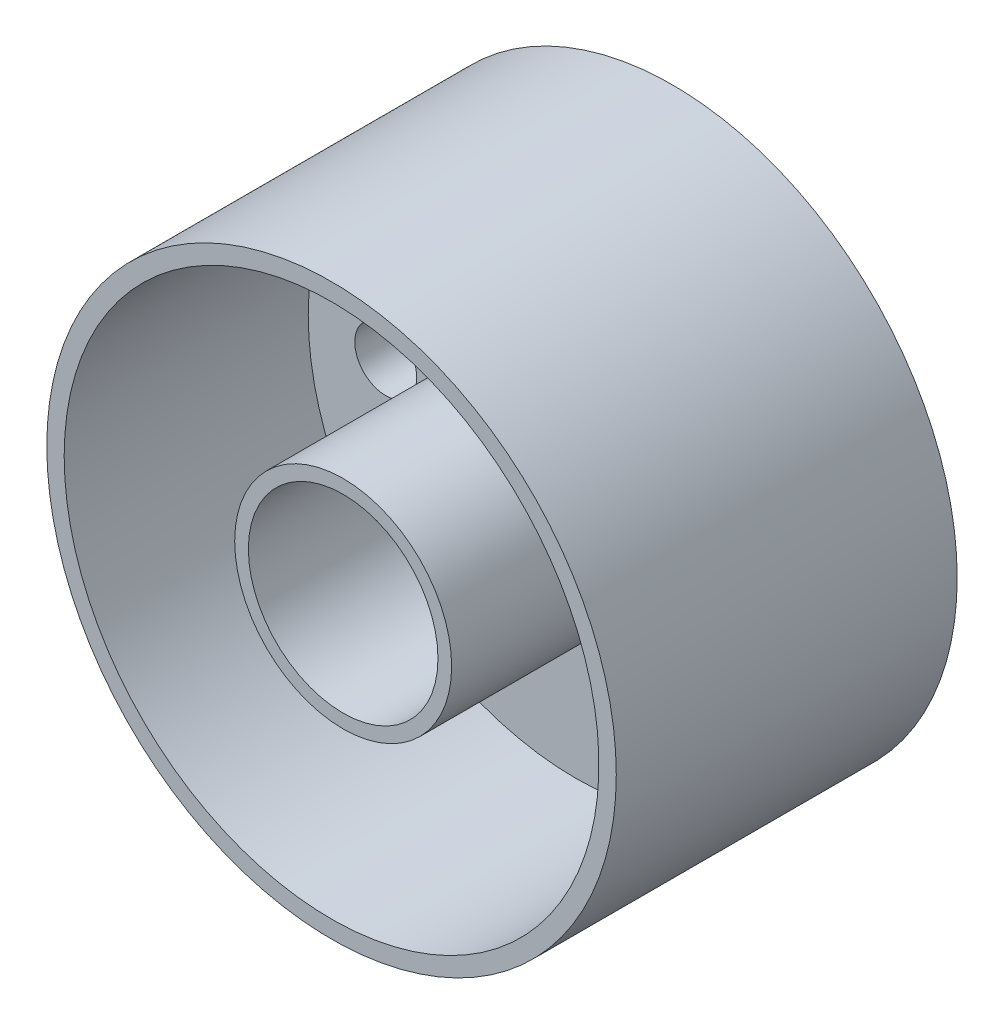
from build123d import *
from build123d.topology import SkipClean

# Parameters (mm, degrees)
SKETCH1_R                = 7.35
SKETCH1_R_2              = 2.45
SKETCH1_R_3              = 0.8
BOSS_EXTRUDE1_DEPTH      = 1.6
SKETCH2_R                = 2.8
SKETCH2_R_2              = 2.447265978
BOSS_EXTRUDE3_DEPTH      = 6
BOSS_EXTRUDE4_DEPTH      = 0.9
BOSS_EXTRUDE4_DEPTH_BACK = 7.9
SKETCH3_R                = 7.35
SKETCH3_R_2              = 6.901593367


with BuildPart() as part:
    # Sketch1 → Boss-Extrude1 (new body)
    with BuildSketch(Plane.XY):
        Circle(SKETCH1_R)
        Circle(SKETCH1_R_2, mode=Mode.SUBTRACT)
        with Locations((-4.9, 0)):
            Circle(SKETCH1_R_3, mode=Mode.SUBTRACT)
        with Locations((-2.45, 4.243524479)):
            Circle(SKETCH1_R_3, mode=Mode.SUBTRACT)
        with Locations((2.45, 4.243524479)):
            Circle(SKETCH1_R_3, mode=Mode.SUBTRACT)
        with Locations((4.9, 0)):
            Circle(SKETCH1_R_3, mode=Mode.SUBTRACT)
        with Locations((2.45, -4.243524479)):
            Circle(SKETCH1_R_3, mode=Mode.SUBTRACT)
        with Locations((-2.45, -4.243524479)):
            Circle(SKETCH1_R_3, mode=Mode.SUBTRACT)
    extrude(amount=BOSS_EXTRUDE1_DEPTH)

    # Sketch2 → Boss-Extrude3 (add)
    with BuildSketch(Plane.XY.offset(1.6)):
        Circle(SKETCH2_R)
        Circle(SKETCH2_R_2, mode=Mode.SUBTRACT)
    extrude(amount=BOSS_EXTRUDE3_DEPTH)

    # Sketch3 → Boss-Extrude4 (add, two sides: drawn at the far end of the back side and taken through both)
    with SkipClean():  # the faces are left unmerged after this step: merging them gives an invalid solid
        with BuildSketch(Plane(origin=(0, 0, 0), x_dir=(-1, 0, 0), z_dir=(0, 0, -1)).offset(-BOSS_EXTRUDE4_DEPTH_BACK)):
            Circle(SKETCH3_R)
            Circle(SKETCH3_R_2, mode=Mode.SUBTRACT)
        extrude(amount=BOSS_EXTRUDE4_DEPTH + BOSS_EXTRUDE4_DEPTH_BACK)


solid = part.part
